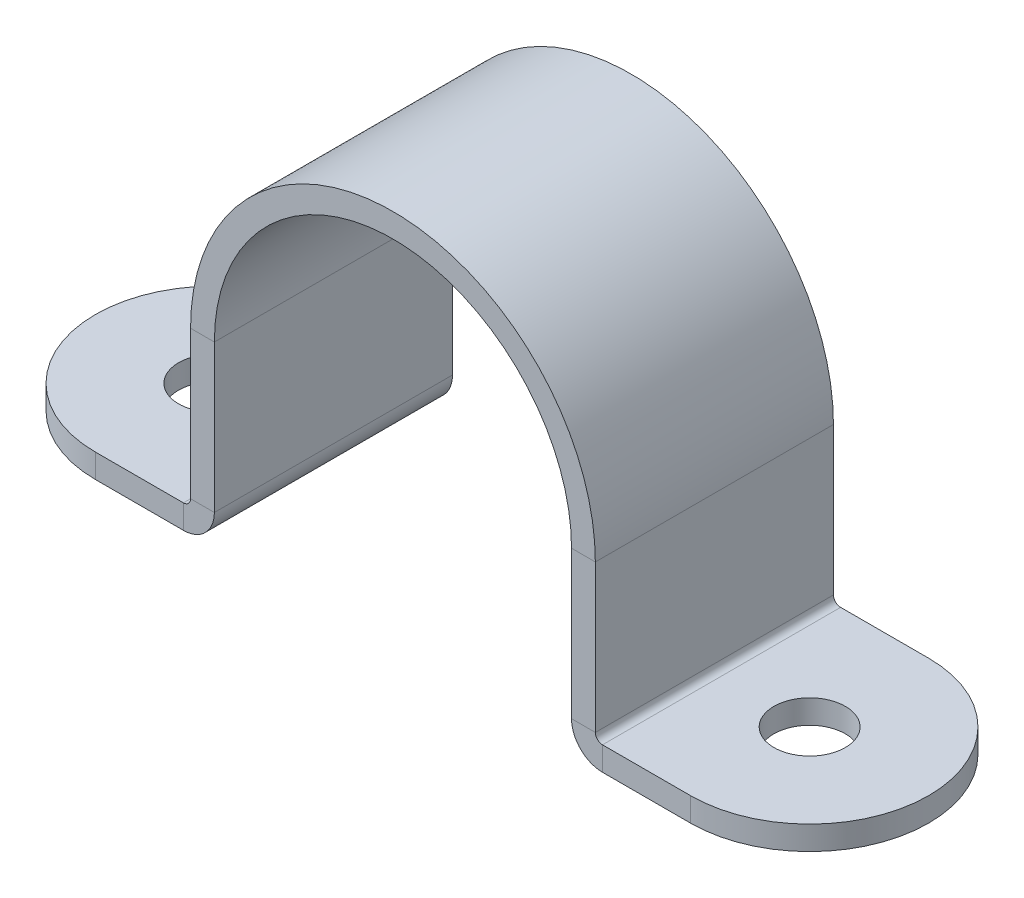
from build123d import *

# Parameters (mm, degrees)
BOSS_EXTRUDE1_DEPTH        = 25.4
SKETCH3_R                  = 3.81
CUT_EXTRUDE1_DEPTH         = 67.100379771
FILLET1_RADIUS             = 12.7
FILLET1_LENGTH             = 2.54
FILLET2_RADIUS             = 12.7
FILLET2_LENGTH             = 2.54
FILLET4_R                  = 19.05
FILLET5_RADIUS             = 21.59
FILLET5_LENGTH             = 25.4
FLATTEN_BENDS3_START       = 2.54
FLATTEN_BENDS3_OUTLINE_W   = 43.18
FLATTEN_BENDS3_OUTLINE_H   = 25.4
FLATTEN_BENDS3_DEPTH       = 38.1
FLATTEN_BENDS3_2_OUTLINE_W = 38.1
FLATTEN_BENDS3_2_OUTLINE_H = 25.4
FLATTEN_BENDS3_2_OUTLINE_R = 3.81
FLATTEN_BENDS3_2_DEPTH     = 2.54
PROCESS_BENDS3_DEPTH       = 25.4
PROCESS_BENDS3_2_OUTLINE_R = 3.81
PROCESS_BENDS3_2_DEPTH     = 2.54
PROCESS_BENDS3_3_DEPTH     = 25.4


# Read off the part's stored shape, not the designer's step: Flatten-Bends3, Process-Bends3
with BuildPart() as part:
    # Sketch2 → Boss-Extrude1 (new body)
    with BuildSketch(Plane.XY):
        Polygon((-43.375384615, 0), (-17.975384615, 0), (-17.975384615, 38.1), (20.124615385, 38.1), (20.124615385, 0), (45.524615385, 0), (45.524615385, 2.54), (22.664615385, 2.54), (22.664615385, 40.64), (-20.515384615, 40.64), (-20.515384615, 2.54), (-43.375384615, 2.54), align=None)
    extrude(amount=BOSS_EXTRUDE1_DEPTH)

    # Sketch3 → Cut-Extrude1 (cut, through all)
    with BuildSketch(Plane.XZ):
        with Locations(Location((-30.675384615, 12.7, 0), (0, 0, 270))):
            Circle(SKETCH3_R)
        with Locations(Location((32.824615385, 12.7, 0), (0, 0, 270))):
            Circle(SKETCH3_R)
    extrude(amount=-CUT_EXTRUDE1_DEPTH, mode=Mode.SUBTRACT)

    # Fillet1: full round fillet: the end face becomes a half cylinder, R = half its width
    fillet1_face = Plane((45.524615385, 1.27, 12.7), x_dir=(0, 1, 0), z_dir=(1, 0, 0))  # on the end face: x along it, z out of the body
    fillet1_slab = fillet1_face.offset(-FILLET1_RADIUS / 2) * Box(FILLET1_LENGTH, 2 * FILLET1_RADIUS, FILLET1_RADIUS, mode=Mode.PRIVATE)  # the body's end, R deep
    fillet1_round = Plane((32.824615385, 1.27, 12.7), x_dir=(1, 0, 0), z_dir=(0, 1, 0)) * Cylinder(FILLET1_RADIUS, FILLET1_LENGTH, mode=Mode.PRIVATE)  # its axis R under the face
    add(fillet1_slab - fillet1_round, mode=Mode.SUBTRACT)

    # Fillet2: full round fillet: the end face becomes a half cylinder, R = half its width
    fillet2_face = Plane((-43.375384615, 1.27, 12.7), x_dir=(0, -1, 0), z_dir=(-1, 0, 0))  # on the end face: x along it, z out of the body
    fillet2_slab = fillet2_face.offset(-FILLET2_RADIUS / 2) * Box(FILLET2_LENGTH, 2 * FILLET2_RADIUS, FILLET2_RADIUS, mode=Mode.PRIVATE)  # the body's end, R deep
    fillet2_round = Plane((-30.675384615, 1.27, 12.7), x_dir=(-1, 0, 0), z_dir=(0, -1, 0)) * Cylinder(FILLET2_RADIUS, FILLET2_LENGTH, mode=Mode.PRIVATE)  # its axis R under the face
    add(fillet2_slab - fillet2_round, mode=Mode.SUBTRACT)

    # Fillet4
    fillet4_edges = [part.edges().sort_by_distance(p)[0] for p in [
        (20.124615385, 38.1, 12.7),
        (-17.975384615, 38.1, 12.7),
    ]]
    fillet(fillet4_edges, radius=FILLET4_R - 0.0001)  # a hair under: the kernel refuses the full size

    # Fillet5: full round fillet: the end face becomes a half cylinder, R = half its width
    fillet5_face = Plane((1.074615385, 40.64, 12.7), x_dir=(0, 0, 1), z_dir=(0, 1, 0))  # on the end face: x along it, z out of the body
    fillet5_slab = fillet5_face.offset(-FILLET5_RADIUS / 2) * Box(FILLET5_LENGTH, 2 * FILLET5_RADIUS, FILLET5_RADIUS, mode=Mode.PRIVATE)  # the body's end, R deep
    fillet5_round = Plane((1.074615385, 19.05, 12.7), x_dir=(0, 1, 0), z_dir=(0, 0, 1)) * Cylinder(FILLET5_RADIUS, FILLET5_LENGTH, mode=Mode.PRIVATE)  # its axis R under the face
    add(fillet5_slab - fillet5_round, mode=Mode.SUBTRACT)

    # Flatten-Bends3 outline → Flatten-Bends3 (cut)
    with BuildSketch(Plane(origin=(0, 0, 0), x_dir=(1, 0, 0), z_dir=(0, 1, 0)).offset(FLATTEN_BENDS3_START)):
        with Locations((1.074615385, -12.7)):
            Rectangle(FLATTEN_BENDS3_OUTLINE_W, FLATTEN_BENDS3_OUTLINE_H)
    extrude(amount=FLATTEN_BENDS3_DEPTH, mode=Mode.SUBTRACT)

    # Flatten-Bends3 2 outline → Flatten-Bends3 2 (add)
    # profile 1 of 3: a face of its own
    with BuildSketch(Plane(origin=(0, 0, 0), x_dir=(1, 0, 0), z_dir=(0, 1, 0))):
        with Locations((1.074615385, -12.7)):
            Rectangle(FLATTEN_BENDS3_2_OUTLINE_W, FLATTEN_BENDS3_2_OUTLINE_H)
    # profile 2 of 3: a face of its own
    with BuildSketch(Plane(origin=(0, 0, 0), x_dir=(1, 0, 0), z_dir=(0, 1, 0))):
        with BuildLine():
            ThreePointArc((32.824615385, 0), (45.524615385, -12.7), (32.824615385, -25.4))
            Line((32.824615385, -25.4), (89.837494378, -25.4))
            ThreePointArc((89.837494378, -25.4), (102.537494378, -12.7), (89.837494378, 0))
            Line((89.837494378, 0), (32.824615385, 0))
        make_face()
        with Locations((89.837494378, -12.7)):
            Circle(FLATTEN_BENDS3_2_OUTLINE_R, mode=Mode.SUBTRACT)
    # profile 3 of 3: a face of its own
    with BuildSketch(Plane(origin=(0, 0, 0), x_dir=(1, 0, 0), z_dir=(0, 1, 0))):
        with Locations((32.824615385, -12.7)):
            Circle(FLATTEN_BENDS3_2_OUTLINE_R)
    extrude(amount=FLATTEN_BENDS3_2_DEPTH)

    # Process-Bends3 outline → Process-Bends3 (add)
    with BuildSketch(Plane.XY):
        with BuildLine():
            Line((22.664615385, 3.302), (22.664615385, 19.05))
            ThreePointArc((22.664615385, 19.05), (1.074615385, 40.64), (-20.515384615, 19.05))
            Line((-20.515384615, 19.05), (-20.515384615, 3.302))
            ThreePointArc((-20.515384615, 3.302), (-20.738569248, 2.763184633), (-21.277384615, 2.54))
            Line((-21.277384615, 2.54), (-18.064510513, 2.54))
            ThreePointArc((-18.064510513, 2.54), (-17.997741777, 2.918402742), (-17.975384615, 3.302))
            Line((-17.975384615, 3.302), (-17.975384615, 19.05))
            ThreePointArc((-17.975384615, 19.05), (1.074615385, 38.1), (20.124615385, 19.05))
            Line((20.124615385, 19.05), (20.124615385, 3.302))
            ThreePointArc((20.124615385, 3.302), (20.146972547, 2.918402742), (20.213741282, 2.54))
            Line((20.213741282, 2.54), (23.426615385, 2.54))
            ThreePointArc((23.426615385, 2.54), (22.887800018, 2.763184632), (22.664615385, 3.302))
        make_face()
    extrude(amount=PROCESS_BENDS3_DEPTH)

    # Process-Bends3 2 outline → Process-Bends3 2 (cut)
    # profile 1 of 2: a face of its own
    with BuildSketch(Plane(origin=(0, 0, 0), x_dir=(1, 0, 0), z_dir=(0, 1, 0))):
        with Locations((32.824615385, -12.7)):
            Circle(PROCESS_BENDS3_2_OUTLINE_R)
    # profile 2 of 2: a face of its own
    with BuildSketch(Plane(origin=(0, 0, 0), x_dir=(1, 0, 0), z_dir=(0, 1, 0))):
        with BuildLine():
            Line((89.837494378, 0), (32.824615385, 0))
            ThreePointArc((32.824615385, 0), (45.524615385, -12.7), (32.824615385, -25.4))
            Line((32.824615385, -25.4), (89.837494378, -25.4))
            ThreePointArc((89.837494378, -25.4), (102.537494378, -12.7), (89.837494378, 0))
        make_face()
        with Locations((89.837494378, -12.7)):
            Circle(PROCESS_BENDS3_2_OUTLINE_R, mode=Mode.SUBTRACT)
    extrude(amount=PROCESS_BENDS3_2_DEPTH, mode=Mode.SUBTRACT)

    # Process-Bends3 3 outline → Process-Bends3 3 (cut)
    with BuildSketch(Plane.XY):
        with BuildLine():
            ThreePointArc((23.426615385, 0), (21.378801917, 0.711698087), (20.213741282, 2.54))
            Line((20.213741282, 2.54), (-18.064510513, 2.54))
            ThreePointArc((-18.064510513, 2.54), (-19.229571147, 0.711698088), (-21.277384615, 0))
            Line((-21.277384615, 0), (23.426615385, 0))
        make_face()
    extrude(amount=PROCESS_BENDS3_3_DEPTH, mode=Mode.SUBTRACT)


solid = part.part
